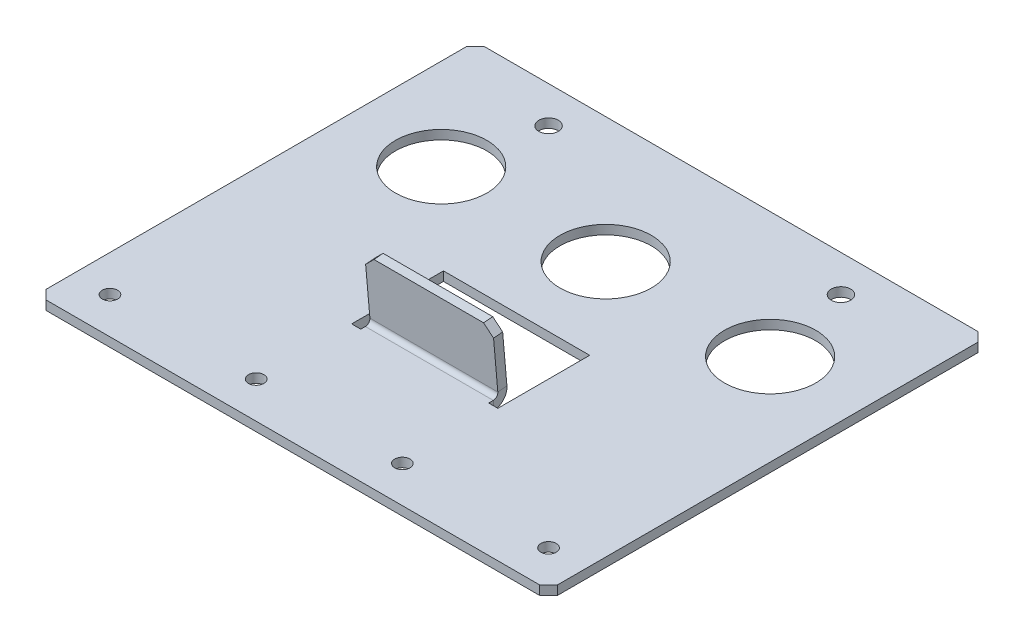
from build123d import *

# Parameters (mm, degrees)
SKETCH1_W            = 177.8
SKETCH1_H            = 152.4
SKETCH1_R            = 3.3782
SKETCH1_R_2          = 2.667
BASE_FLANGE1_DEPTH   = 3.175
CHAMFER2_SIZE        = 3.175
SKETCH7_W            = 50.8
SKETCH7_H            = 25.4
CUT_EXTRUDE2_DEPTH   = 235.197951795
EDGE_FLANGE1_START   = 65.0875
EDGE_FLANGE1_DEPTH   = 47.625
EDGE_FLANGE1_2_DEPTH = 1.5875
EDGE_FLANGE1_START_2 = 111.125
EDGE_FLANGE1_3_DEPTH = 1.5875
EDGE_FLANGE1_START_3 = 66.675
EDGE_FLANGE1_4_DEPTH = 44.45
SKETCH11_W           = 1.5875
SKETCH11_H           = 6.50708023
CUT_EXTRUDE3_DEPTH   = 236.219607319
CHAMFER3_SIZE        = 3.175
SKETCH12_R           = 15.875
CUT_EXTRUDE4_DEPTH   = 236.219607319


# Read off the part's stored shape, not the designer's step: Edge-Flange1
# Sheet-metal steps are written as plain solids
with BuildPart() as part:
    # Sketch1 → Base-Flange1 (new body)
    with BuildSketch(Plane(origin=(0, 0, 0), x_dir=(1, 0, 0), z_dir=(0, 1, 0))):
        with Locations((88.9, 76.2)):
            Rectangle(SKETCH1_W, SKETCH1_H)
        with Locations(Location((38.1, 139.7, 0), (0, 0, 270))):
            Circle(SKETCH1_R, mode=Mode.SUBTRACT)
        with Locations(Location((139.7, 139.7, 0), (0, 0, 90))):
            Circle(SKETCH1_R, mode=Mode.SUBTRACT)
        with Locations(Location((12.7, 12.7, 0), (0, 0, 270))):
            Circle(SKETCH1_R_2, mode=Mode.SUBTRACT)
        with Locations(Location((165.1, 12.7, 0), (0, 0, 90))):
            Circle(SKETCH1_R_2, mode=Mode.SUBTRACT)
        with Locations(Location((63.5, 12.7, 0), (0, 0, 270))):
            Circle(SKETCH1_R_2, mode=Mode.SUBTRACT)
        with Locations(Location((114.3, 12.7, 0), (0, 0, 90))):
            Circle(SKETCH1_R_2, mode=Mode.SUBTRACT)
    extrude(amount=-BASE_FLANGE1_DEPTH)

    # Chamfer2
    chamfer2_edges = [part.edges().sort_by_distance(p)[0] for p in [
        (0, -1.5875, -152.4),
        (177.8, -1.5875, -152.4),
        (177.8, -1.5875, 0),
        (0, -1.5875, 0),
    ]]
    chamfer(chamfer2_edges, length=CHAMFER2_SIZE)

    # Sketch7 → Cut-Extrude2 (cut, through all)
    with BuildSketch(Plane(origin=(0, 0, 0), x_dir=(1, 0, 0), z_dir=(0, 1, 0))):
        with Locations((88.9, 65.0875)):
            Rectangle(SKETCH7_W, SKETCH7_H)
    extrude(amount=-CUT_EXTRUDE2_DEPTH, mode=Mode.SUBTRACT)

    # Edge-Flange1 outline → Edge-Flange1 (cut)
    with BuildSketch(Plane.YZ.offset(EDGE_FLANGE1_START)):
        with BuildLine():
            ThreePointArc((0, -51.958047831), (-2.301064967, -50.217550427), (-3.175, -47.46791977))
            Line((-3.175, -47.46791977), (-3.175, -52.3875))
            Line((-3.175, -52.3875), (0, -52.3875))
            Line((0, -52.3875), (0, -51.958047831))
        make_face()
    extrude(amount=EDGE_FLANGE1_DEPTH, mode=Mode.SUBTRACT)

    # Edge-Flange1 2 outline → Edge-Flange1 2 (cut)
    with BuildSketch(Plane.YZ.offset(EDGE_FLANGE1_START)):
        with BuildLine():
            Line((0, -45.88041977), (-3.175, -45.88041977))
            Line((-3.175, -45.88041977), (-3.175, -47.46791977))
            ThreePointArc((-3.175, -47.46791977), (-2.301064967, -50.217550427), (0, -51.958047831))
            Line((0, -51.958047831), (0, -45.88041977))
        make_face()
    extrude(amount=EDGE_FLANGE1_2_DEPTH, mode=Mode.SUBTRACT)

    # Edge-Flange1 3 outline → Edge-Flange1 3 (cut)
    with BuildSketch(Plane.YZ.offset(EDGE_FLANGE1_START_2)):
        with BuildLine():
            Line((0, -45.88041977), (-3.175, -45.88041977))
            Line((-3.175, -45.88041977), (-3.175, -47.46791977))
            ThreePointArc((-3.175, -47.46791977), (-2.301064967, -50.217550427), (0, -51.958047831))
            Line((0, -51.958047831), (0, -45.88041977))
        make_face()
    extrude(amount=EDGE_FLANGE1_3_DEPTH, mode=Mode.SUBTRACT)

    # Edge-Flange1 4 outline → Edge-Flange1 4 (add)
    with BuildSketch(Plane.YZ.offset(EDGE_FLANGE1_START_3)):
        with BuildLine():
            ThreePointArc((1.725859742, -49.049378854), (0.515000545, -48.638347543), (0, -47.46791977))
            Line((0, -47.46791977), (0, -51.958047831))
            ThreePointArc((0, -51.958047831), (0.987663955, -52.19249414), (2.002579225, -52.21229702))
            Line((2.002579225, -52.21229702), (22.128345332, -50.451520641))
            Line((22.128345332, -50.451520641), (21.851625848, -47.288602474))
            Line((21.851625848, -47.288602474), (1.725859742, -49.049378854))
        make_face()
    extrude(amount=EDGE_FLANGE1_4_DEPTH)

    # Sketch11 → Cut-Extrude3 (cut, through all)
    with BuildSketch(Plane(origin=(0, 0, 0), x_dir=(1, 0, 0), z_dir=(0, 1, 0))):
        with Locations((64.29375, 49.133959885)):
            Rectangle(SKETCH11_W, SKETCH11_H)
        with Locations((113.50625, 49.133959885)):
            Rectangle(SKETCH11_W, SKETCH11_H)
    extrude(amount=-CUT_EXTRUDE3_DEPTH, mode=Mode.SUBTRACT)

    # Chamfer3
    chamfer3_edges = [part.edges().sort_by_distance(p)[0] for p in [
        (111.125, 21.98998559, -48.870061558),
        (66.675, 21.98998559, -48.870061558),
    ]]
    chamfer(chamfer3_edges, length=CHAMFER3_SIZE)

    # Sketch12 → Cut-Extrude4 (cut, through all)
    with BuildSketch(Plane(origin=(0, 0, 0), x_dir=(1, 0, 0), z_dir=(0, 1, 0))):
        with Locations(Location((88.9, 108.74375, 0), (0, 0, 270))):
            Circle(SKETCH12_R)
        with Locations(Location((146.05, 108.74375, 0), (0, 0, 270))):
            Circle(SKETCH12_R)
        with Locations(Location((31.75, 108.74375, 0), (0, 0, 270))):
            Circle(SKETCH12_R)
    extrude(amount=-CUT_EXTRUDE4_DEPTH, mode=Mode.SUBTRACT)


solid = part.part
